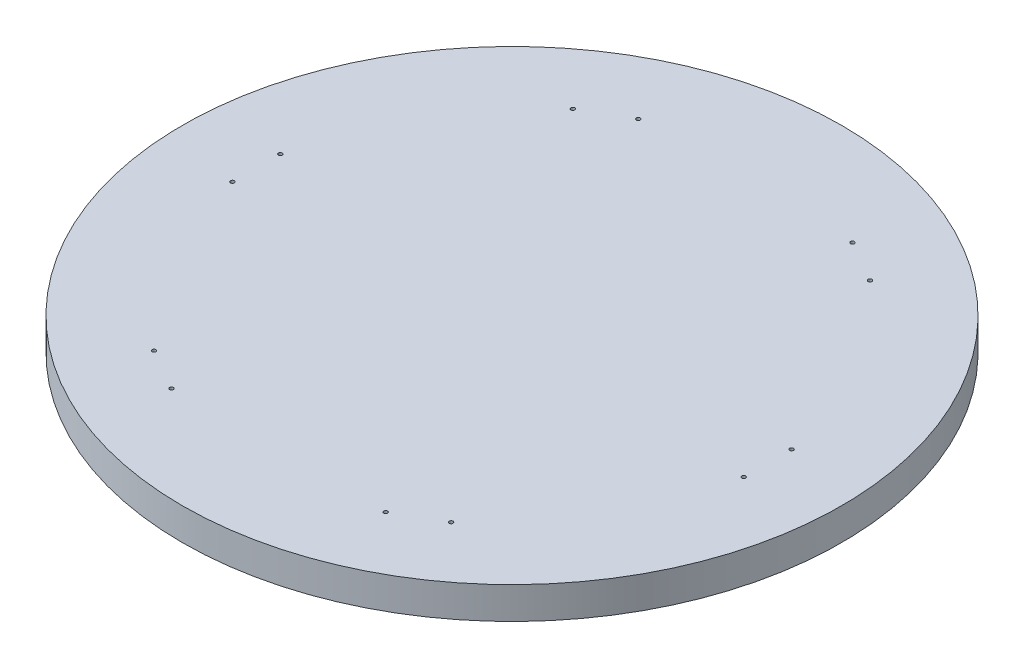
from build123d import *

# Parameters (mm, degrees)
SKETCH1_R           = 261.9375
BOSS_EXTRUDE1_DEPTH = 25.4
CUT_EXTRUDE4_DEPTH  = 12.7
SKETCH9_R           = 25.4
BOSS_EXTRUDE2_DEPTH = 10.16
CUT_EXTRUDE7_DEPTH  = 19.05
CUT_EXTRUDE9_DEPTH  = 6.35
SKETCH12_R          = 1.524
CUT_EXTRUDE10_DEPTH = 372.140253021


with BuildPart() as part:
    # Sketch1 → Boss-Extrude1 (new body)
    with BuildSketch(Plane(origin=(0, 0, 0), x_dir=(1, 0, 0), z_dir=(0, 1, 0))):
        Circle(SKETCH1_R)
    extrude(amount=BOSS_EXTRUDE1_DEPTH)

    # Sketch6 → Cut-Extrude4 (cut)
    with BuildSketch(Plane.XZ):
        with BuildLine():
            Line((215.9, 19.05), (215.9, -19.05))
            ThreePointArc((215.9, -19.05), (203.2, -31.75), (190.5, -19.05))
            Line((190.5, -19.05), (190.5, 19.05))
            ThreePointArc((190.5, 19.05), (203.2, 31.75), (215.9, 19.05))
        make_face()
        with BuildLine():
            Line((124.447783942, -177.449884677), (91.452216058, -196.499884677))
            ThreePointArc((91.452216058, -196.499884677), (74.10369343, -191.851362049), (78.752216058, -174.502839421))
            Line((78.752216058, -174.502839421), (111.747783942, -155.452839421))
            ThreePointArc((111.747783942, -155.452839421), (129.09630657, -160.101362049), (124.447783942, -177.449884677))
        make_face()
        with BuildLine():
            Line((-91.452216058, -196.499884677), (-124.447783942, -177.449884677))
            ThreePointArc((-124.447783942, -177.449884677), (-129.09630657, -160.101362049), (-111.747783942, -155.452839421))
            Line((-111.747783942, -155.452839421), (-78.752216058, -174.502839421))
            ThreePointArc((-78.752216058, -174.502839421), (-74.10369343, -191.851362049), (-91.452216058, -196.499884677))
        make_face()
        with BuildLine():
            Line((-215.9, -19.05), (-215.9, 19.05))
            ThreePointArc((-215.9, 19.05), (-203.2, 31.75), (-190.5, 19.05))
            Line((-190.5, 19.05), (-190.5, -19.05))
            ThreePointArc((-190.5, -19.05), (-203.2, -31.75), (-215.9, -19.05))
        make_face()
        with BuildLine():
            Line((-124.447783942, 177.449884677), (-91.452216058, 196.499884677))
            ThreePointArc((-91.452216058, 196.499884677), (-74.10369343, 191.851362049), (-78.752216058, 174.502839421))
            Line((-78.752216058, 174.502839421), (-111.747783942, 155.452839421))
            ThreePointArc((-111.747783942, 155.452839421), (-129.09630657, 160.101362049), (-124.447783942, 177.449884677))
        make_face()
        with BuildLine():
            Line((91.452216058, 196.499884677), (124.447783942, 177.449884677))
            ThreePointArc((124.447783942, 177.449884677), (129.09630657, 160.101362049), (111.747783942, 155.452839421))
            Line((111.747783942, 155.452839421), (78.752216058, 174.502839421))
            ThreePointArc((78.752216058, 174.502839421), (74.10369343, 191.851362049), (91.452216058, 196.499884677))
        make_face()
    extrude(amount=-CUT_EXTRUDE4_DEPTH, mode=Mode.SUBTRACT)

    # Sketch9 → Boss-Extrude2 (add)
    with BuildSketch(Plane.XZ):
        Circle(SKETCH9_R)
    extrude(amount=BOSS_EXTRUDE2_DEPTH)

    # Sketch10 → Cut-Extrude7 (cut)
    with BuildSketch(Plane.XZ.offset(10.16)):
        with BuildLine():
            Line((-1.344041666, 1.524), (1.344041666, 1.524))
            ThreePointArc((1.344041666, 1.524), (0, -2.032), (-1.344041666, 1.524))
        make_face()
    extrude(amount=-CUT_EXTRUDE7_DEPTH, mode=Mode.SUBTRACT)

    # Sketch11 → Cut-Extrude9 (cut)
    with BuildSketch(Plane.XZ):
        with BuildLine():
            ThreePointArc((0, -177.449152316), (-5.23157566, -171.878090085), (-11.120138026, -176.749532533))
            ThreePointArc((-11.120138026, -176.749532533), (-17.052716739, -182.320594765), (-22.240276053, -176.049912749))
            ThreePointArc((-22.240276053, -176.049912749), (-26.732359932, -169.867089713), (-33.18504286, -173.96208682))
            ThreePointArc((-33.18504286, -173.96208682), (-39.769080661, -178.745670288), (-44.129809667, -171.87426089))
            ThreePointArc((-44.129809667, -171.87426089), (-47.811558919, -165.177183862), (-54.726599743, -168.431155078))
            ThreePointArc((-54.726599743, -168.431155078), (-61.858262424, -172.351819814), (-65.32338982, -164.988049265))
            ThreePointArc((-65.32338982, -164.988049265), (-68.13674106, -157.882335151), (-75.405085457, -160.243963404))
            ThreePointArc((-75.405085457, -160.243963404), (-82.971902437, -163.239878184), (-85.486781094, -155.499877543))
            ThreePointArc((-85.486781094, -155.499877543), (-87.387366093, -148.097587699), (-94.894387928, -149.529628703))
            ThreePointArc((-94.894387928, -149.529628703), (-102.777025983, -151.55354616), (-104.301994762, -143.559379862))
            ThreePointArc((-104.301994762, -143.559379862), (-105.259840159, -135.977252821), (-112.887149214, -136.457122432))
            ThreePointArc((-112.887149214, -136.457122432), (-120.961294433, -137.477124179), (-121.472303666, -129.354865002))
            ThreePointArc((-121.472303666, -129.354865002), (-121.472303666, -121.712475436), (-129.099612722, -121.232605825))
            ThreePointArc((-129.099612722, -121.232605825), (-137.237931011, -121.232605825), (-136.726921778, -113.110346648))
            ThreePointArc((-136.726921778, -113.110346648), (-135.769076381, -105.528219606), (-143.276098217, -104.096178603))
            ThreePointArc((-143.276098217, -104.096178603), (-151.350243435, -103.076176856), (-149.825274656, -95.082010558))
            ThreePointArc((-149.825274656, -95.082010558), (-147.924689657, -87.679720714), (-155.193034054, -85.318092461))
            ThreePointArc((-155.193034054, -85.318092461), (-163.075672108, -83.294175004), (-160.560793451, -75.554174363))
            ThreePointArc((-160.560793451, -75.554174363), (-157.747442211, -68.448460249), (-164.662483036, -65.194489034))
            ThreePointArc((-164.662483036, -65.194489034), (-172.229300015, -62.198574254), (-168.76417262, -54.834803705))
            ThreePointArc((-168.76417262, -54.834803705), (-165.082423368, -48.137726677), (-171.535106296, -44.04272957))
            ThreePointArc((-171.535106296, -44.04272957), (-178.666768977, -40.122064833), (-174.306039971, -33.250655435))
            ThreePointArc((-174.306039971, -33.250655435), (-169.813956092, -27.067832398), (-175.702518459, -22.19638995))
            ThreePointArc((-175.702518459, -22.19638995), (-182.286556261, -17.412806481), (-177.098996947, -11.142124466))
            ThreePointArc((-177.098996947, -11.142124466), (-171.867421287, -5.571062234), (-177.098996947, -2e-09))
            ThreePointArc((-177.098996947, -2e-09), (-183.03157566, 5.57106223), (-177.098996947, 11.142124462))
            ThreePointArc((-177.098996947, 11.142124462), (-171.21043458, 16.01356691), (-175.702518459, 22.196389946))
            ThreePointArc((-175.702518459, 22.196389946), (-180.890077773, 28.467071962), (-174.306039971, 33.250655431))
            ThreePointArc((-174.306039971, 33.250655431), (-167.853357043, 37.345652538), (-171.535106296, 44.042729566))
            ThreePointArc((-171.535106296, 44.042729566), (-175.895835301, 50.914138964), (-168.76417262, 54.834803701))
            ThreePointArc((-168.76417262, 54.834803701), (-161.849131795, 58.088774916), (-164.662483036, 65.19448903))
            ThreePointArc((-164.662483036, 65.19448903), (-168.127610431, 72.55825958), (-160.560793451, 75.554174359))
            ThreePointArc((-160.560793451, 75.554174359), (-153.292449055, 77.915802613), (-155.193034054, 85.318092457))
            ThreePointArc((-155.193034054, 85.318092457), (-157.707912711, 93.058093097), (-149.825274656, 95.082010555))
            ThreePointArc((-149.825274656, 95.082010555), (-142.31825282, 96.514051558), (-143.276098217, 104.096178599))
            ThreePointArc((-143.276098217, 104.096178599), (-144.801066996, 112.090344897), (-136.726921778, 113.110346644))
            ThreePointArc((-136.726921778, 113.110346644), (-129.099612722, 113.590216255), (-129.099612722, 121.232605821))
            ThreePointArc((-129.099612722, 121.232605821), (-129.610621956, 129.354864998), (-121.472303666, 129.354864998))
            ThreePointArc((-121.472303666, 129.354864998), (-113.844994611, 128.874995387), (-112.887149214, 136.457122428))
            ThreePointArc((-112.887149214, 136.457122428), (-112.376139981, 144.579381605), (-104.301994762, 143.559379858))
            ThreePointArc((-104.301994762, 143.559379858), (-96.794972927, 142.127338855), (-94.894387928, 149.529628699))
            ThreePointArc((-94.894387928, 149.529628699), (-93.369419148, 157.523794996), (-85.486781094, 155.499877539))
            ThreePointArc((-85.486781094, 155.499877539), (-78.218436697, 153.138249286), (-75.405085457, 160.2439634))
            ThreePointArc((-75.405085457, 160.2439634), (-72.8902068, 167.983964041), (-65.32338982, 164.988049261))
            ThreePointArc((-65.32338982, 164.988049261), (-58.408348996, 161.734078046), (-54.726599743, 168.431155074))
            ThreePointArc((-54.726599743, 168.431155074), (-51.261472348, 175.794925623), (-44.129809667, 171.874260886))
            ThreePointArc((-44.129809667, 171.874260886), (-37.677126739, 167.77926378), (-33.18504286, 173.962086816))
            ThreePointArc((-33.18504286, 173.962086816), (-28.824313854, 180.833496214), (-22.240276053, 176.049912745))
            ThreePointArc((-22.240276053, 176.049912745), (-16.351713686, 171.178470297), (-11.120138026, 176.749532529))
            ThreePointArc((-11.120138026, 176.749532529), (-5.932578713, 183.020214545), (0, 177.449152313))
            ThreePointArc((0, 177.449152313), (5.23157566, 171.878090081), (11.120138026, 176.749532529))
            ThreePointArc((11.120138026, 176.749532529), (17.052716739, 182.320594761), (22.240276053, 176.049912745))
            ThreePointArc((22.240276053, 176.049912745), (26.732359932, 169.867089709), (33.18504286, 173.962086816))
            ThreePointArc((33.18504286, 173.962086816), (39.769080661, 178.745670285), (44.129809667, 171.874260886))
            ThreePointArc((44.129809667, 171.874260886), (47.811558919, 165.177183859), (54.726599743, 168.431155074))
            ThreePointArc((54.726599743, 168.431155074), (61.858262424, 172.35181981), (65.32338982, 164.988049261))
            ThreePointArc((65.32338982, 164.988049261), (68.13674106, 157.882335147), (75.405085457, 160.2439634))
            ThreePointArc((75.405085457, 160.2439634), (82.971902437, 163.23987818), (85.486781094, 155.499877539))
            ThreePointArc((85.486781094, 155.499877539), (87.387366093, 148.097587695), (94.894387928, 149.529628699))
            ThreePointArc((94.894387928, 149.529628699), (102.777025983, 151.553546156), (104.301994762, 143.559379858))
            ThreePointArc((104.301994762, 143.559379858), (105.259840159, 135.977252817), (112.887149214, 136.457122428))
            ThreePointArc((112.887149214, 136.457122428), (120.961294433, 137.477124175), (121.472303666, 129.354864998))
            ThreePointArc((121.472303666, 129.354864998), (121.472303666, 121.712475432), (129.099612722, 121.232605821))
            ThreePointArc((129.099612722, 121.232605821), (137.237931011, 121.232605821), (136.726921778, 113.110346644))
            ThreePointArc((136.726921778, 113.110346644), (135.769076381, 105.528219603), (143.276098217, 104.096178599))
            ThreePointArc((143.276098217, 104.096178599), (151.350243435, 103.076176852), (149.825274656, 95.082010555))
            ThreePointArc((149.825274656, 95.082010555), (147.924689657, 87.67972071), (155.193034054, 85.318092457))
            ThreePointArc((155.193034054, 85.318092457), (163.075672108, 83.294175), (160.560793451, 75.554174359))
            ThreePointArc((160.560793451, 75.554174359), (157.747442211, 68.448460245), (164.662483036, 65.19448903))
            ThreePointArc((164.662483036, 65.19448903), (172.229300015, 62.19857425), (168.76417262, 54.834803701))
            ThreePointArc((168.76417262, 54.834803701), (165.082423368, 48.137726673), (171.535106296, 44.042729566))
            ThreePointArc((171.535106296, 44.042729566), (178.666768977, 40.122064829), (174.306039971, 33.250655431))
            ThreePointArc((174.306039971, 33.250655431), (169.813956092, 27.067832395), (175.702518459, 22.196389946))
            ThreePointArc((175.702518459, 22.196389946), (182.286556261, 17.412806478), (177.098996947, 11.142124462))
            ThreePointArc((177.098996947, 11.142124462), (171.867421287, 5.57106223), (177.098996947, -2e-09))
            ThreePointArc((177.098996947, -2e-09), (183.03157566, -5.571062234), (177.098996947, -11.142124466))
            ThreePointArc((177.098996947, -11.142124466), (171.21043458, -16.013566914), (175.702518459, -22.19638995))
            ThreePointArc((175.702518459, -22.19638995), (180.890077773, -28.467071966), (174.306039971, -33.250655435))
            ThreePointArc((174.306039971, -33.250655435), (167.853357043, -37.345652542), (171.535106296, -44.04272957))
            ThreePointArc((171.535106296, -44.04272957), (175.895835301, -50.914138968), (168.76417262, -54.834803705))
            ThreePointArc((168.76417262, -54.834803705), (161.849131795, -58.08877492), (164.662483036, -65.194489034))
            ThreePointArc((164.662483036, -65.194489034), (168.127610431, -72.558259583), (160.560793451, -75.554174363))
            ThreePointArc((160.560793451, -75.554174363), (153.292449055, -77.915802617), (155.193034054, -85.318092461))
            ThreePointArc((155.193034054, -85.318092461), (157.707912711, -93.058093101), (149.825274656, -95.082010558))
            ThreePointArc((149.825274656, -95.082010558), (142.31825282, -96.514051562), (143.276098217, -104.096178603))
            ThreePointArc((143.276098217, -104.096178603), (144.801066996, -112.090344901), (136.726921778, -113.110346648))
            ThreePointArc((136.726921778, -113.110346648), (129.099612722, -113.590216259), (129.099612722, -121.232605825))
            ThreePointArc((129.099612722, -121.232605825), (129.610621956, -129.354865002), (121.472303666, -129.354865002))
            ThreePointArc((121.472303666, -129.354865002), (113.844994611, -128.87499539), (112.887149214, -136.457122432))
            ThreePointArc((112.887149214, -136.457122432), (112.376139981, -144.579381609), (104.301994762, -143.559379862))
            ThreePointArc((104.301994762, -143.559379862), (96.794972927, -142.127338858), (94.894387928, -149.529628703))
            ThreePointArc((94.894387928, -149.529628703), (93.369419148, -157.523795), (85.486781094, -155.499877543))
            ThreePointArc((85.486781094, -155.499877543), (78.218436697, -153.13824929), (75.405085457, -160.243963404))
            ThreePointArc((75.405085457, -160.243963404), (72.8902068, -167.983964045), (65.32338982, -164.988049265))
            ThreePointArc((65.32338982, -164.988049265), (58.408348996, -161.73407805), (54.726599743, -168.431155078))
            ThreePointArc((54.726599743, -168.431155078), (51.261472348, -175.794925627), (44.129809667, -171.87426089))
            ThreePointArc((44.129809667, -171.87426089), (37.677126739, -167.779263783), (33.18504286, -173.96208682))
            ThreePointArc((33.18504286, -173.96208682), (28.824313854, -180.833496218), (22.240276053, -176.049912749))
            ThreePointArc((22.240276053, -176.049912749), (16.351713686, -171.178470301), (11.120138026, -176.749532533))
            ThreePointArc((11.120138026, -176.749532533), (5.932578713, -183.020214548), (0, -177.449152316))
        make_face()
    extrude(amount=-CUT_EXTRUDE9_DEPTH, mode=Mode.SUBTRACT)


with BuildPart() as cut_extrude9_piece_1:
    # of the separate pieces the step leaves, piece 1, a body of its own (cut_extrude9_pieces)
    add(part.part.solids().sort_by_distance((261.9375, 0, 0))[0])

    # Sketch12 → Cut-Extrude10 (cut, through all)
    with BuildSketch(Plane.XZ.offset(-12.7)):
        with Locations((203.2, -19.05)):
            Circle(SKETCH12_R)
        with Locations((203.2, 19.05)):
            Circle(SKETCH12_R)
        with Locations((85.102215311, -185.50136223)):
            Circle(SKETCH12_R)
        with Locations((118.097783195, -166.45136223)):
            Circle(SKETCH12_R)
        with Locations((-118.097785219, -166.451361674)):
            Circle(SKETCH12_R)
        with Locations((-85.102217335, -185.501361674)):
            Circle(SKETCH12_R)
        with Locations((-203.20000106, 19.050001113)):
            Circle(SKETCH12_R)
        with Locations((-203.20000106, -19.049998887)):
            Circle(SKETCH12_R)
        with Locations((-85.102216371, 185.501363343)):
            Circle(SKETCH12_R)
        with Locations((-118.097784256, 166.451363343)):
            Circle(SKETCH12_R)
        with Locations((118.097784159, 166.451362786)):
            Circle(SKETCH12_R)
        with Locations((85.102216275, 185.501362786)):
            Circle(SKETCH12_R)
    extrude(amount=-CUT_EXTRUDE10_DEPTH, mode=Mode.SUBTRACT)


with BuildPart() as cut_extrude9_piece_2:
    # of the separate pieces the step leaves, piece 2, a body of its own (cut_extrude9_pieces)
    add(part.part.solids().sort_by_distance((25.4, 0, 0))[0])


solid = Compound([cut_extrude9_piece_1.part, cut_extrude9_piece_2.part])
